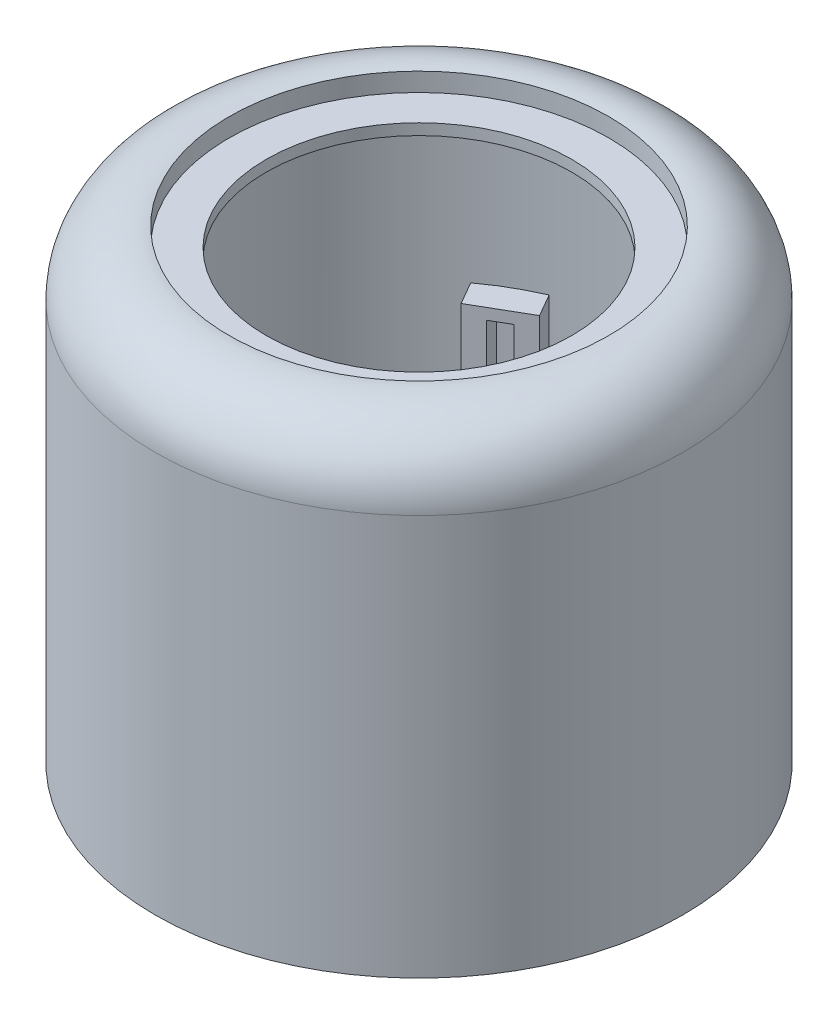
from build123d import *

# Parameters (mm, degrees)
SKETCH_5_W          = 4
SKETCH_5_H          = 2
EXTRUDE_1_DEPTH     = 26
SKETCH_6_W          = 3.5
SKETCH_6_H          = 6.2
EXTRUDE_2_DEPTH     = 1.2
CUT_EXTRUDE_1_REACH = 66.434
SKETCH_7_R          = 1.4


with BuildPart() as part:
    # 草图4 → 旋转1 (revolve)
    with BuildSketch(Plane(origin=(0, 0, 0), x_dir=(0, 0, -1), z_dir=(1, 0, 0))):
        with BuildLine():
            Line((16.5, 48.2), (16.5, 47))
            Line((16.5, 47), (22, 47))
            ThreePointArc((22, 47), (25.535533906, 45.535533906), (27, 42))
            Line((27, 42), (27, 0))
            Line((27, 0), (28.5, 0))
            Line((28.5, 0), (28.5, 43.27179677))
            ThreePointArc((28.5, 43.27179677), (26.082575695, 48.563299392), (20.5, 50.2))
            Line((20.5, 50.2), (20.5, 48.2))
            Line((20.5, 48.2), (16.5, 48.2))
        make_face()
    revolve(axis=Axis((0, 0, 0), (0, 1, 0)))

    # 草图5 → 凸台-拉伸1 (add)
    with BuildSketch(Plane.XZ):
        with Locations((26, 2.1)):
            Rectangle(SKETCH_5_W, SKETCH_5_H)
        with Locations((26, -2.1)):
            Rectangle(SKETCH_5_W, SKETCH_5_H)
        Polygon((16.684678752, -22.698711306), (14.684678752, -19.234609691), (12.952627944, -20.234609691), (14.952627944, -23.698711306), align=None)
        Polygon((13.047372056, -24.798711306), (11.315321248, -25.798711306), (9.315321248, -22.334609691), (11.047372056, -21.334609691), align=None)
        Polygon((-11.315321248, -25.798711306), (-9.315321248, -22.334609691), (-11.047372056, -21.334609691), (-13.047372056, -24.798711306), align=None)
        Polygon((-14.952627944, -23.698711306), (-16.684678752, -22.698711306), (-14.684678752, -19.234609691), (-12.952627944, -20.234609691), align=None)
        with Locations((-26, -2.1)):
            Rectangle(SKETCH_5_W, SKETCH_5_H)
        with Locations((-26, 2.1)):
            Rectangle(SKETCH_5_W, SKETCH_5_H)
        Polygon((-16.684678752, 22.698711306), (-14.684678752, 19.234609691), (-12.952627944, 20.234609691), (-14.952627944, 23.698711306), align=None)
        Polygon((-13.047372056, 24.798711306), (-11.315321248, 25.798711306), (-9.315321248, 22.334609691), (-11.047372056, 21.334609691), align=None)
        Polygon((11.315321248, 25.798711306), (9.315321248, 22.334609691), (11.047372056, 21.334609691), (13.047372056, 24.798711306), align=None)
        Polygon((14.952627944, 23.698711306), (16.684678752, 22.698711306), (14.684678752, 19.234609691), (12.952627944, 20.234609691), align=None)
    extrude(amount=-EXTRUDE_1_DEPTH)

    # 草图6 → 凸台-拉伸2 (add)
    with BuildSketch(Plane(origin=(0, 26, 0), x_dir=(1, 0, 0), z_dir=(0, 1, 0))):
        Polygon((9.315321248, -22.334609691), (11.065321248, -25.365698604), (16.434678752, -22.265698604), (14.684678752, -19.234609691), align=None)
        with Locations((25.75, 0)):
            Rectangle(SKETCH_6_W, SKETCH_6_H)
        Polygon((-14.684678752, -19.234609691), (-16.434678752, -22.265698604), (-11.065321248, -25.365698604), (-9.315321248, -22.334609691), align=None)
        with Locations((-25.75, 0)):
            Rectangle(SKETCH_6_W, SKETCH_6_H)
        Polygon((-9.315321248, 22.334609691), (-11.065321248, 25.365698604), (-16.434678752, 22.265698604), (-14.684678752, 19.234609691), align=None)
        Polygon((14.684678752, 19.234609691), (16.434678752, 22.265698604), (11.065321248, 25.365698604), (9.315321248, 22.334609691), align=None)
    extrude(amount=-EXTRUDE_2_DEPTH)

    # 草图7 → 切除-拉伸1 (cut, up to next)
    with BuildSketch(Plane.XY, mode=Mode.PRIVATE) as cut_extrude_1_sk1:
        with Locations((0, 14.2)):
            Circle(SKETCH_7_R)
    cut_extrude_1_tool1 = extrude(cut_extrude_1_sk1.sketch, amount=-CUT_EXTRUDE_1_REACH, mode=Mode.PRIVATE) & part.part
    add(cut_extrude_1_tool1.solids().sort_by_distance((0, 14.2, 0))[0], mode=Mode.SUBTRACT)


solid = part.part
